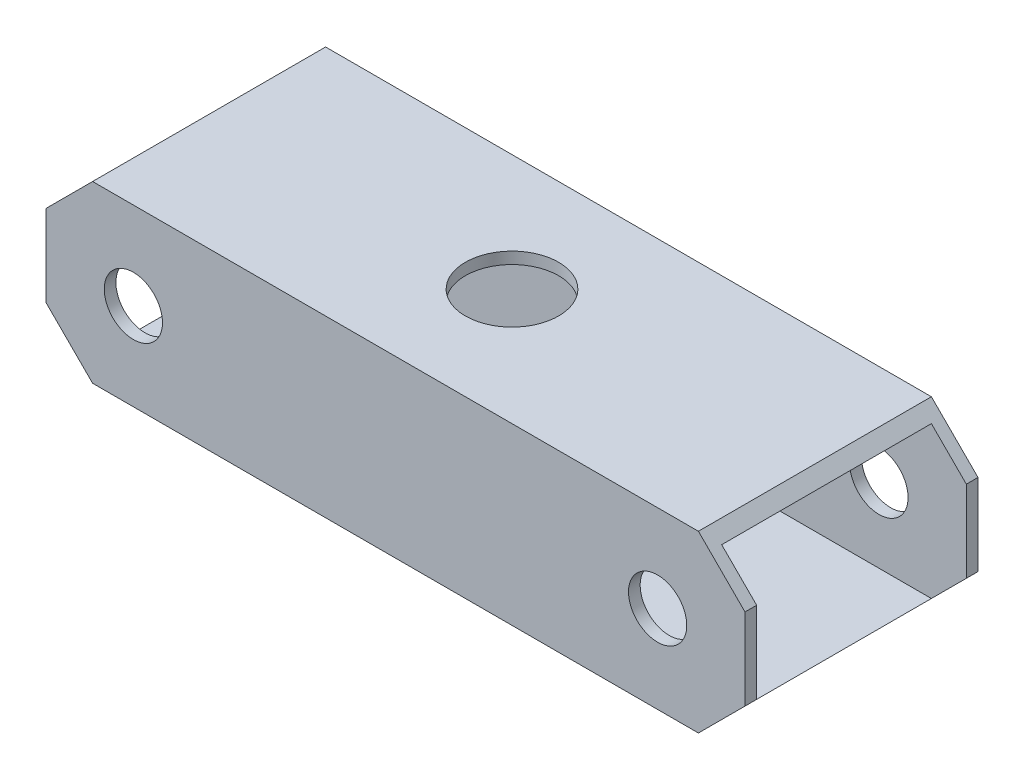
from build123d import *

# Parameters (mm, degrees)
SKETCH1_W           = 120
SKETCH1_H           = 40
BOSS_EXTRUDE3_DEPTH = 30
SKETCH3_R           = 5
CUT_EXTRUDE2_DEPTH  = 131
CUT_EXTRUDE3_DEPTH  = 120
SKETCH6_R           = 8
CUT_EXTRUDE4_DEPTH  = 120
CHAMFER2_SIZE       = 8


with BuildPart() as part:
    # Sketch1 → Boss-Extrude3 (new body)
    with BuildSketch(Plane(origin=(0, 0, 0), x_dir=(1, 0, 0), z_dir=(0, 1, 0))):
        with Locations((60, 20)):
            Rectangle(SKETCH1_W, SKETCH1_H)
    extrude(amount=BOSS_EXTRUDE3_DEPTH)

    # Sketch3 → Cut-Extrude2 (cut, through all)
    with BuildSketch(Plane(origin=(0, 0, -40), x_dir=(-1, 0, 0), z_dir=(0, 0, -1))):
        with Locations((-105, 15)):
            Circle(SKETCH3_R)
        with Locations(Location((-15, 15, 0), (0, 0, 180))):
            Circle(SKETCH3_R)
    extrude(amount=-CUT_EXTRUDE2_DEPTH, mode=Mode.SUBTRACT)

    # 3DSketch1 → Cut-Extrude3 (cut)
    with BuildSketch(Plane(origin=(0, 28, -2), x_dir=(0, -0.5854905538443583, -0.8106792283998812), z_dir=(-1, 0, 0))):
        Polygon((0, 0), (29.184452222, -21.077659938), (44.407206622, 0), (15.2227544, 21.077659938), align=None)
    extrude(amount=-CUT_EXTRUDE3_DEPTH, mode=Mode.SUBTRACT)

    # Sketch6 → Cut-Extrude4 (cut)
    with BuildSketch(Plane(origin=(0, 30, 0), x_dir=(1, 0, 0), z_dir=(0, 1, 0))):
        with Locations(Location((60, 20, 0), (0, 0, 270))):
            Circle(SKETCH6_R)
    extrude(amount=-CUT_EXTRUDE4_DEPTH, mode=Mode.SUBTRACT)

    # Chamfer2
    # the kernel refuses this chamfer: 8 mm, written as the material it takes off along each edge
    with BuildSketch(Plane(origin=(0, 0, -60.573463904), x_dir=(-0.027495876610586372, 0.9996219169112968, 0), z_dir=(0, 0, 1)), Plane(origin=(120, 30, 20.573463904), x_dir=(-0.9996219169112968, 0.02749587661058651, 0), z_dir=(0, 0, -1))) as chamfer2_piece_1:
        Polygon((CHAMFER2_SIZE * 0.999621916911, -CHAMFER2_SIZE * 0.0274958766106), (-CHAMFER2_SIZE * 0.0274958766106, -CHAMFER2_SIZE * 0.999621916911), (0, 0), align=None)
    extrude(amount=81.146927807, mode=Mode.SUBTRACT)
    with BuildSketch(Plane(origin=(0, 30, -60.573463904), x_dir=(-0.027495876610586365, -0.9996219169112968, 0), z_dir=(0, 0, 1)), Plane(origin=(120, 0, 20.573463904), x_dir=(-0.9996219169112968, -0.02749587661058639, 0), z_dir=(0, 0, -1))) as chamfer2_piece_2:
        Polygon((CHAMFER2_SIZE * 0.999621916911, CHAMFER2_SIZE * 0.0274958766106), (-CHAMFER2_SIZE * 0.0274958766106, CHAMFER2_SIZE * 0.999621916911), (0, 0), align=None)
    extrude(amount=81.146927807, mode=Mode.SUBTRACT)


solid = part.part
